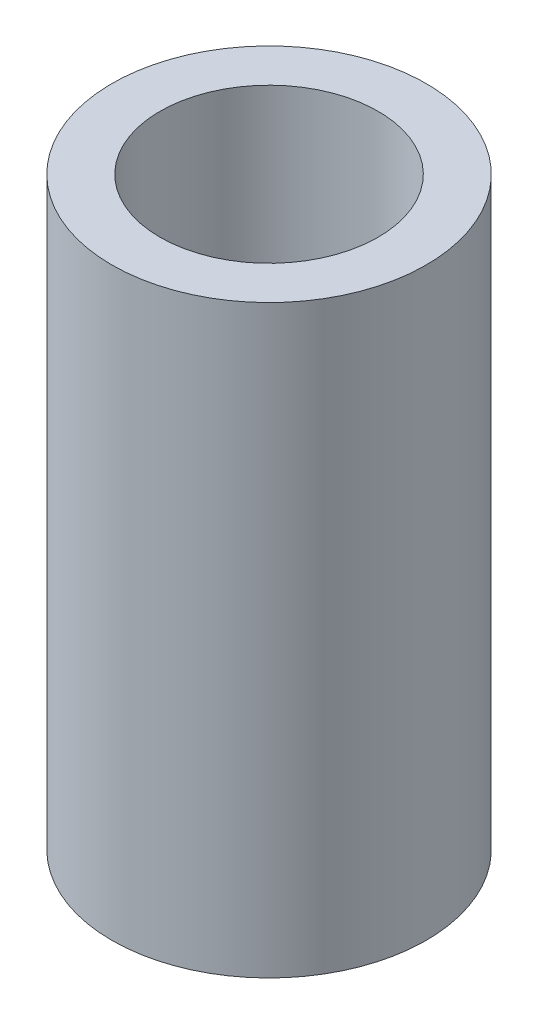
from build123d import *

# Parameters (mm, degrees)
SKETCH1_R           = 12.5
BOSS_EXTRUDE1_DEPTH = 46.523252048
SKETCH2_R           = 8.677708066
CUT_EXTRUDE1_DEPTH  = 50.768594326


with BuildPart() as part:
    # Sketch1 → Boss-Extrude1 (new body)
    with BuildSketch(Plane(origin=(0, 0, 0), x_dir=(1, 0, 0), z_dir=(0, 1, 0))):
        Circle(SKETCH1_R)
    extrude(amount=BOSS_EXTRUDE1_DEPTH)

    # Sketch2 → Cut-Extrude1 (cut, through all)
    with BuildSketch(Plane(origin=(0, 0, 0), x_dir=(1, 0, 0), z_dir=(0, 1, 0))):
        Circle(SKETCH2_R)
    extrude(amount=CUT_EXTRUDE1_DEPTH, mode=Mode.SUBTRACT)


solid = part.part
